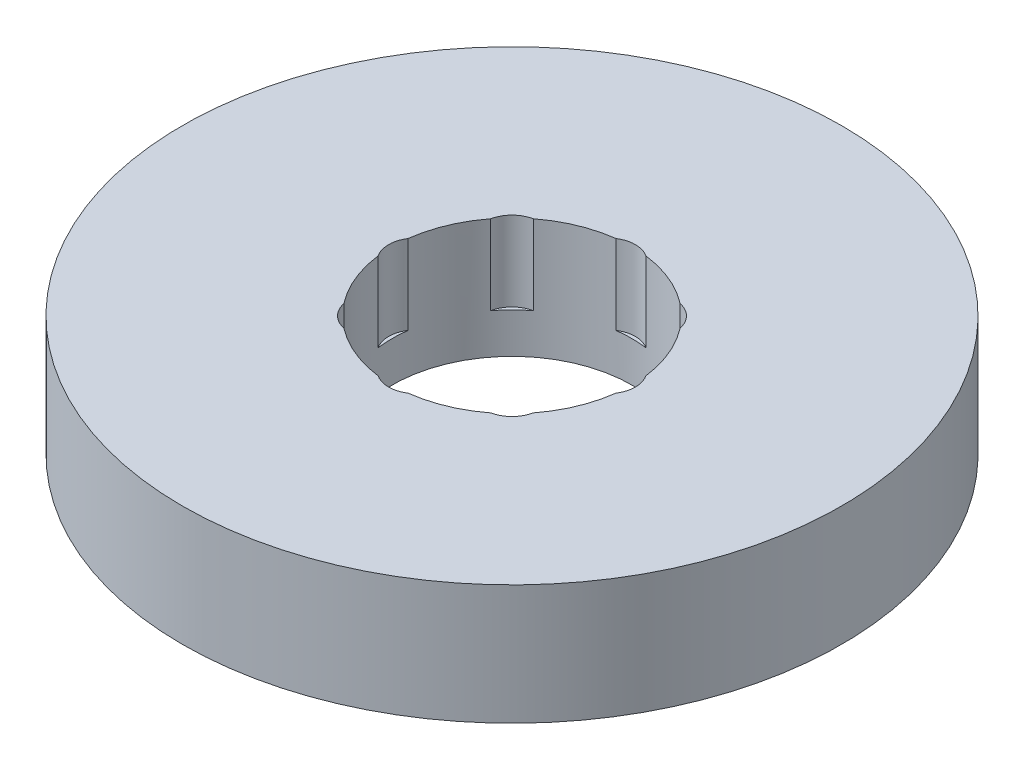
from build123d import *

# Parameters (mm, degrees)
SKETCH1_R           = 82.5
BOSS_EXTRUDE1_DEPTH = 30
SKETCH2_R           = 30
CUT_EXTRUDE1_DEPTH  = 121.467838032
SKETCH3_R           = 6.886038884
CUT_EXTRUDE2_DEPTH  = 19.915918388
CIRPATTERN1_COUNT   = 8


with BuildPart() as part:
    # Sketch1 → Boss-Extrude1 (new body)
    with BuildSketch(Plane(origin=(0, 0, 0), x_dir=(1, 0, 0), z_dir=(0, 1, 0))):
        Circle(SKETCH1_R)
    extrude(amount=BOSS_EXTRUDE1_DEPTH)

    # Sketch2 → Cut-Extrude1 (cut, through all)
    with BuildSketch(Plane(origin=(0, 0, 0), x_dir=(1, 0, 0), z_dir=(0, 1, 0))):
        Circle(SKETCH2_R)
    extrude(amount=CUT_EXTRUDE1_DEPTH, mode=Mode.SUBTRACT)

    # Sketch3 → Cut-Extrude2 (cut)
    with BuildSketch(Plane(origin=(0, 30, 0), x_dir=(1, 0, 0), z_dir=(0, 1, 0))):
        with Locations((-23.99767359, 0)):
            Circle(SKETCH3_R)
    cut_extrude2 = extrude(amount=-CUT_EXTRUDE2_DEPTH, mode=Mode.SUBTRACT)

    # CirPattern1: Cut-Extrude2 ×8 about axis
    cirpattern1_axis = Axis((0, 0, 0), (0, 1, 0))
    for i in range(1, CIRPATTERN1_COUNT):
        add(cut_extrude2.rotate(cirpattern1_axis, i * 360 / CIRPATTERN1_COUNT), mode=Mode.SUBTRACT)


solid = part.part
